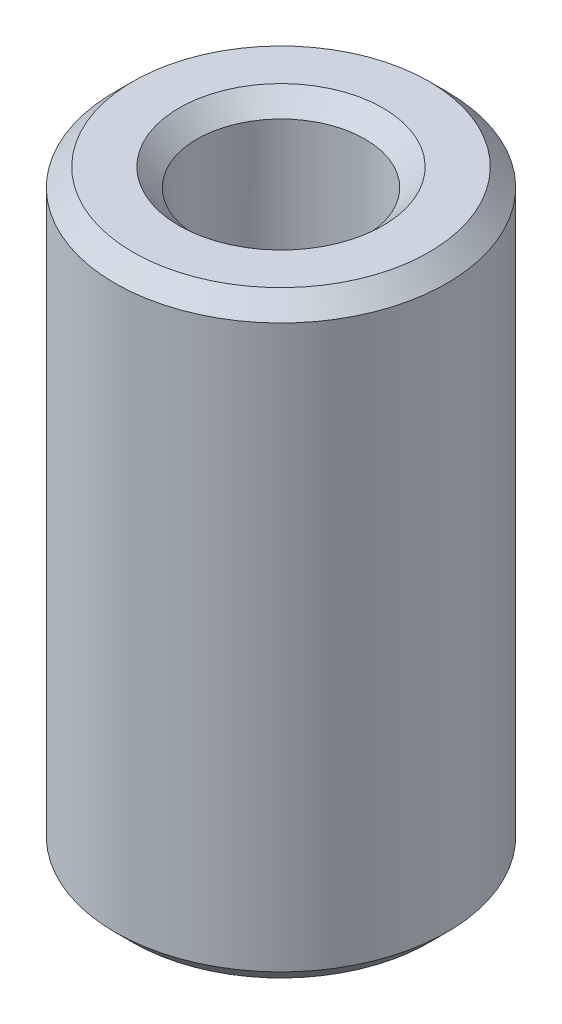
from build123d import *

# Parameters (mm, degrees)
SKETCH1_R           = 12.5
BOSS_EXTRUDE1_DEPTH = 45.036096793
SKETCH2_R           = 6.32734711
CUT_EXTRUDE1_DEPTH  = 49.381298188
CHAMFER1_SIZE       = 1.352230611


with BuildPart() as part:
    # Sketch1 → Boss-Extrude1 (new body)
    with BuildSketch(Plane(origin=(0, 0, 0), x_dir=(1, 0, 0), z_dir=(0, 1, 0))):
        Circle(SKETCH1_R)
    extrude(amount=BOSS_EXTRUDE1_DEPTH)

    # Sketch2 → Cut-Extrude1 (cut, through all)
    with BuildSketch(Plane(origin=(0, 0, 0), x_dir=(1, 0, 0), z_dir=(0, 1, 0))):
        Circle(SKETCH2_R)
    extrude(amount=CUT_EXTRUDE1_DEPTH, mode=Mode.SUBTRACT)

    # Chamfer1
    chamfer1_edges = [part.edges().sort_by_distance(p)[0] for p in [
        (-6.32734711, 45.036096793, 0),
        (-6.32734711, 0, 0),
        (-12.5, 0, 0),
        (-12.5, 45.036096793, 0),
    ]]
    chamfer(chamfer1_edges, length=CHAMFER1_SIZE)


solid = part.part
